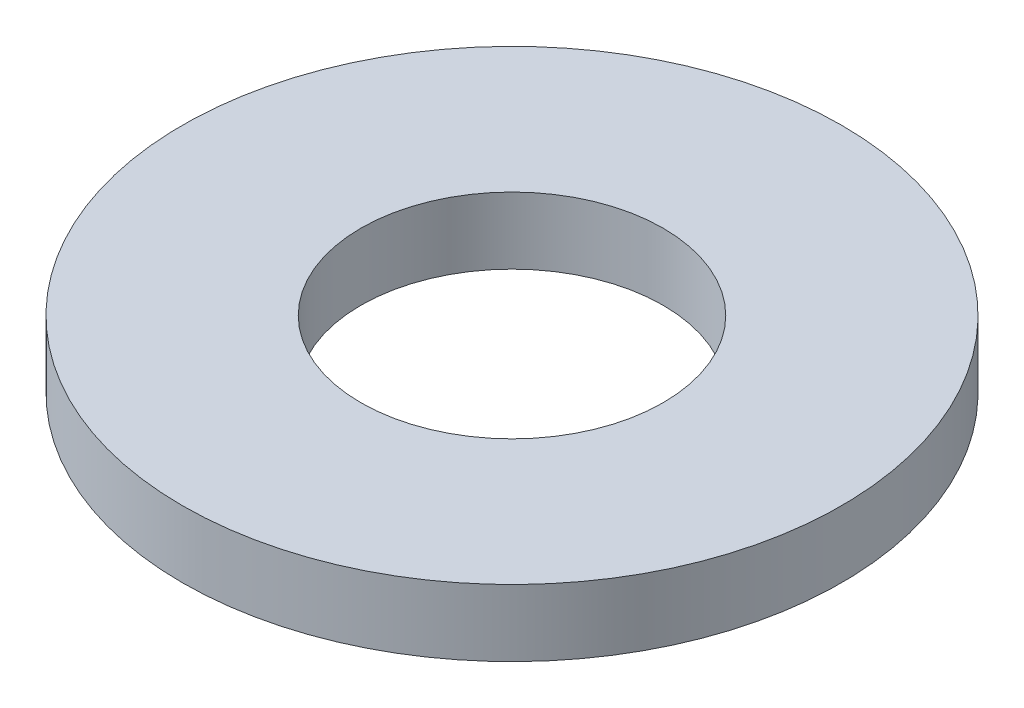
from build123d import *

# Parameters (mm, degrees)
SKETCH1_R           = 4.7625
BOSS_EXTRUDE1_DEPTH = 0.9652
SKETCH5_R           = 2.1844
CUT_EXTRUDE1_DEPTH  = 7.804000554


with BuildPart() as part:
    # Sketch1 → Boss-Extrude1 (new body)
    with BuildSketch(Plane(origin=(0, 0, 0), x_dir=(1, 0, 0), z_dir=(0, 1, 0))):
        Circle(SKETCH1_R)
    extrude(amount=BOSS_EXTRUDE1_DEPTH)

    # Sketch5 → Cut-Extrude1 (cut, through all)
    with BuildSketch(Plane(origin=(0, 0.9652, 0), x_dir=(-1, 0, 0), z_dir=(0, 1, 0))):
        Circle(SKETCH5_R)
    extrude(amount=-CUT_EXTRUDE1_DEPTH, mode=Mode.SUBTRACT)


solid = part.part
